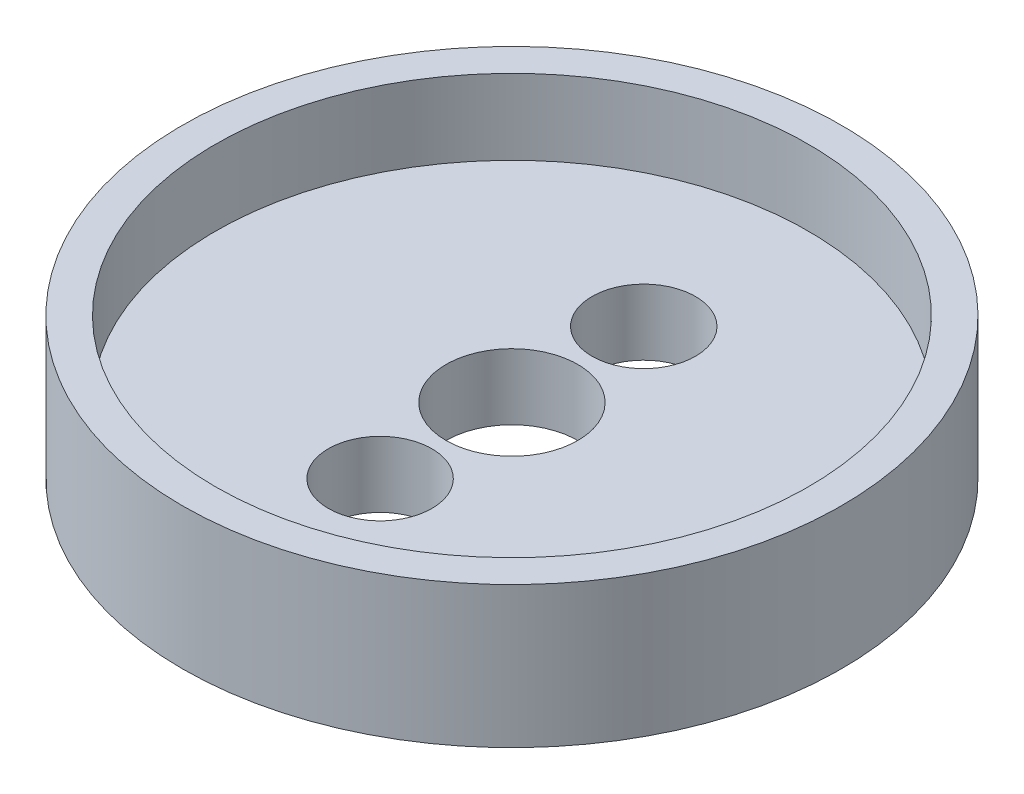
from build123d import *

# Parameters (mm, degrees)
SKETCH4_R        = 17.5
SKETCH4_R_2      = 2.75
SKETCH4_R_3      = 3.5
LIDBASE_DEPTH    = 7.5
SKETCH5_R        = 15.75
LIDGROOVES_DEPTH = 4


with BuildPart() as part:
    # Sketch4 → LidBase (new body)
    with BuildSketch(Plane(origin=(0, 0, 0), x_dir=(1, 0, 0), z_dir=(0, 1, 0))):
        Circle(SKETCH4_R)
        with Locations((0, -7)):
            Circle(SKETCH4_R_2, mode=Mode.SUBTRACT)
        with Locations((0, 7)):
            Circle(SKETCH4_R_2, mode=Mode.SUBTRACT)
        Circle(SKETCH4_R_3, mode=Mode.SUBTRACT)
    extrude(amount=LIDBASE_DEPTH)

    # Sketch5 → LidGrooves (cut)
    with BuildSketch(Plane(origin=(0, 7.5, 0), x_dir=(1, 0, 0), z_dir=(0, 1, 0))):
        Circle(SKETCH5_R)
    extrude(amount=-LIDGROOVES_DEPTH, mode=Mode.SUBTRACT)


solid = part.part
